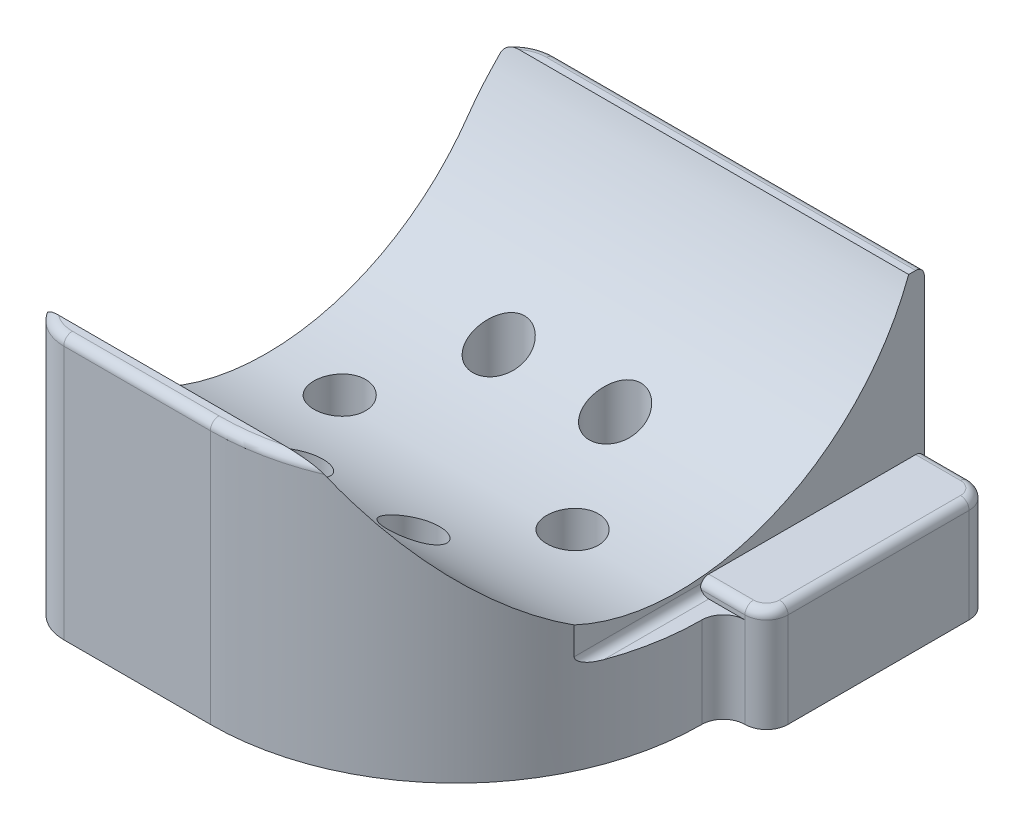
from build123d import *

# Parameters (mm, degrees)
EXTRUDE_1_DEPTH     = 40.5
SKETCH_2_R          = 1.75
CUT_EXTRUDE_1_DEPTH = 44
FILLET_6_R          = 5
SKETCH_5_R          = 3
CUT_EXTRUDE_2_DEPTH = 35
SKETCH_6_R          = 7.5
CUT_EXTRUDE_3_DEPTH = 10
CUT_EXTRUDE_4_REACH = 76.382
SKETCH_8_R          = 28.5
SKETCH_4_W          = 7.7
SKETCH_4_H          = 50
CUT_EXTRUDE_5_DEPTH = 30
SKETCH_9_W          = 74.837423064
SKETCH_9_H          = 60.925338007
CUT_EXTRUDE_6_DEPTH = 10
SKETCH_11_W         = 7.7
SKETCH_11_H         = 26
EXTRUDE_2_DEPTH     = 1.5
FILLET_12_R         = 2.5
FILLET_13_R         = 1
FILLET_14_R         = 1
FILLET_15_R         = 2.5
FILLET_START        = 25.8
FILLET_16_DEPTH     = 8.2
FILLET_16_2_ANGLE   = 90
FILLET_17_R         = 1


with BuildPart() as part:
    # 草图1 → 凸台-拉伸1 (new body)
    with BuildSketch(Plane(origin=(0, 0, 0), x_dir=(1, 0, 0), z_dir=(0, 1, 0))):
        with BuildLine():
            Line((0, 28.5), (-22, 28.5))
            Line((-22, 28.5), (-22, -28.5))
            Line((-22, -28.5), (0, -28.5))
            ThreePointArc((0, -28.5), (20.152543264, -20.152543264), (28.5, 0))
            Line((28.5, 0), (28.5, 2.5))
            Line((28.5, 2.5), (33.5, 2.5))
            Line((33.5, 2.5), (33.5, 28.5))
            Line((33.5, 28.5), (0, 28.5))
        make_face()
    extrude(amount=EXTRUDE_1_DEPTH)

    # 草图2 → 切除-拉伸1 (cut)
    with BuildSketch(Plane(origin=(0, 40.5, 0), x_dir=(1, 0, 0), z_dir=(0, 1, 0))):
        with Locations(Location((-13.5, 0, 0), (0, 0, 270))):
            Circle(SKETCH_2_R)
        with Locations(Location((-6.75, 11.691342951, 0), (0, 0, 270))):
            Circle(SKETCH_2_R)
        with Locations(Location((6.75, 11.691342951, 0), (0, 0, 270))):
            Circle(SKETCH_2_R)
        with Locations(Location((13.5, 0, 0), (0, 0, 270))):
            Circle(SKETCH_2_R)
        with Locations(Location((6.75, -11.691342951, 0), (0, 0, 270))):
            Circle(SKETCH_2_R)
        with Locations(Location((-6.75, -11.691342951, 0), (0, 0, 270))):
            Circle(SKETCH_2_R)
    extrude(amount=-CUT_EXTRUDE_1_DEPTH, mode=Mode.SUBTRACT)

    # 圆角6
    fillet_6_edges = [part.edges().sort_by_distance(p)[0] for p in [
        (-22, 20.25, 28.5),
        (-22, 20.25, -28.5),
    ]]
    fillet(fillet_6_edges, radius=FILLET_6_R)

    # 草图5 → 切除-拉伸2 (cut)
    with BuildSketch(Plane(origin=(0, 40.5, 0), x_dir=(1, 0, 0), z_dir=(0, 1, 0))):
        with Locations(Location((-13.5, 0, 0), (0, 0, 270))):
            Circle(SKETCH_5_R)
        with Locations(Location((-6.75, 11.691342951, 0), (0, 0, 270))):
            Circle(SKETCH_5_R)
        with Locations(Location((6.75, 11.691342951, 0), (0, 0, 270))):
            Circle(SKETCH_5_R)
        with Locations(Location((13.5, 0, 0), (0, 0, 270))):
            Circle(SKETCH_5_R)
        with Locations(Location((6.75, -11.691342951, 0), (0, 0, 270))):
            Circle(SKETCH_5_R)
        with Locations(Location((-6.75, -11.691342951, 0), (0, 0, 270))):
            Circle(SKETCH_5_R)
    extrude(amount=-CUT_EXTRUDE_2_DEPTH, mode=Mode.SUBTRACT)

    # 草图6 → 切除-拉伸3 (cut)
    with BuildSketch(Plane(origin=(0, 40.5, 0), x_dir=(1, 0, 0), z_dir=(0, 1, 0))):
        with Locations(Location((0, 0, 0), (0, 0, 270))):
            Circle(SKETCH_6_R)
    extrude(amount=-CUT_EXTRUDE_3_DEPTH, mode=Mode.SUBTRACT)

    # 切除-拉伸4: up to this face of the body (flat: up to its plane)
    cut_extrude_4_end = Plane(part.part.faces().sort_by_distance((28.5, 20.25, -1.25))[0])
    # 草图8 → 切除-拉伸4 (cut, up to the picked face)
    with BuildSketch(Plane.ZY.offset(22), mode=Mode.PRIVATE) as cut_extrude_4_sk1:
        with Locations((0, 40.5)):
            Circle(SKETCH_8_R)
    cut_extrude_4_tool1 = split(extrude(cut_extrude_4_sk1.sketch, amount=-CUT_EXTRUDE_4_REACH, mode=Mode.PRIVATE), bisect_by=cut_extrude_4_end, keep=Keep.BOTH, mode=Mode.PRIVATE)
    add(cut_extrude_4_tool1.solids().sort_by(Axis((-22, 40.5, 0), (1, 0, 0)))[0], mode=Mode.SUBTRACT)

    # 草图4 → 切除-拉伸5 (cut)
    with BuildSketch(Plane(origin=(0, 40.5, 0), x_dir=(1, 0, 0), z_dir=(0, 1, 0))):
        with Locations((29.65, 3.5)):
            Rectangle(SKETCH_4_W, SKETCH_4_H)
    extrude(amount=-CUT_EXTRUDE_5_DEPTH, mode=Mode.SUBTRACT)

    # 草图9 → 切除-拉伸6 (cut)
    with BuildSketch(Plane(origin=(0, 40.5, 0), x_dir=(1, 0, 0), z_dir=(0, 1, 0))):
        with Locations((5.520272929, 0.012240625)):
            Rectangle(SKETCH_9_W, SKETCH_9_H)
    extrude(amount=-CUT_EXTRUDE_6_DEPTH, mode=Mode.SUBTRACT)

    # 草图11 → 凸台-拉伸2 (add)
    with BuildSketch(Plane(origin=(0, 10.5, 0), x_dir=(1, 0, 0), z_dir=(0, 1, 0))):
        with Locations((29.65, 15.5)):
            Rectangle(SKETCH_11_W, SKETCH_11_H)
    extrude(amount=EXTRUDE_2_DEPTH)

    # 圆角12
    fillet_12_edges = [part.edges().sort_by_distance(p)[0] for p in [
        (33.5, 6, -2.5),
        (28.5, 5.25, -2.5),
    ]]
    fillet(fillet_12_edges, radius=FILLET_12_R - 0.0001)  # a hair under: the kernel refuses the full size

    # 圆角13
    fillet_13_edges = [part.edges().sort_by_distance(p)[0] for p in [
        (25.8, 10.5, 4.804130821),
    ]]
    fillet(fillet_13_edges, radius=FILLET_13_R)

    # 圆角14
    fillet_14_edges = [part.edges().sort_by_distance(p)[0] for p in [
        (33.5, 12, -16.74995),
        (32.767796242, 12, -3.232203758),
        (28.40005, 12, -2.5),
    ]]
    fillet(fillet_14_edges, radius=FILLET_14_R)

    # 圆角15
    # the kernel refuses this fillet: 2.5 mm, written as the material it takes off along each edge
    with BuildSketch(Plane(origin=(33.5, 17.25, -28.5), x_dir=(-1, 0, 0), z_dir=(0, -1, 0))) as fillet_15_piece_1:
        with BuildLine():
            CenterArc((FILLET_15_R, -FILLET_15_R), FILLET_15_R, 90, 90)
            Line((0, -FILLET_15_R), (0, 0))
            Line((0, 0), (FILLET_15_R, 0))
        make_face()
    extrude(amount=23.5, mode=Mode.SUBTRACT)

    # 圆角16: read off the stored shape, not the designer's step
    # 圆角16 outline → 圆角16 (cut)
    with BuildSketch(Plane.YZ.offset(FILLET_START)):
        with BuildLine():
            Line((12, -28.5), (12, -27.5))
            ThreePointArc((12, -27.5), (11.707106781, -28.207106781), (11, -28.5))
            Line((11, -28.5), (12, -28.5))
        make_face()
    extrude(amount=FILLET_16_DEPTH, mode=Mode.SUBTRACT)

    # Fillet 16 2 outline → Fillet 16 2 (revolve, cut)
    with BuildSketch(Plane(origin=(31, 0, -26), x_dir=(1, 0, 0), z_dir=(0, 0, 1))):
        with BuildLine():
            Line((2.5, 12), (1.5, 12))
            ThreePointArc((1.5, 12), (2.207106781, 11.707106781), (2.5, 11))
            Line((2.5, 11), (2.5, 12))
        make_face()
    revolve(axis=Axis((31, 0, -26), (0, 1, 0)), revolution_arc=FILLET_16_2_ANGLE, mode=Mode.SUBTRACT)

    # 圆角17
    fillet_17_edges = [part.edges().sort_by_distance(p)[0] for p in [
        (-19.128372458, 30.5, -28.024381801),
        (4.4, 30.5, -28.5),
        (-19.128372458, 30.5, 28.024381801),
        (5.081419572, 30.5, 28.043344578),
        (-8.5, 30.5, 28.5),
    ]]
    fillet(fillet_17_edges, radius=FILLET_17_R)


solid = part.part
